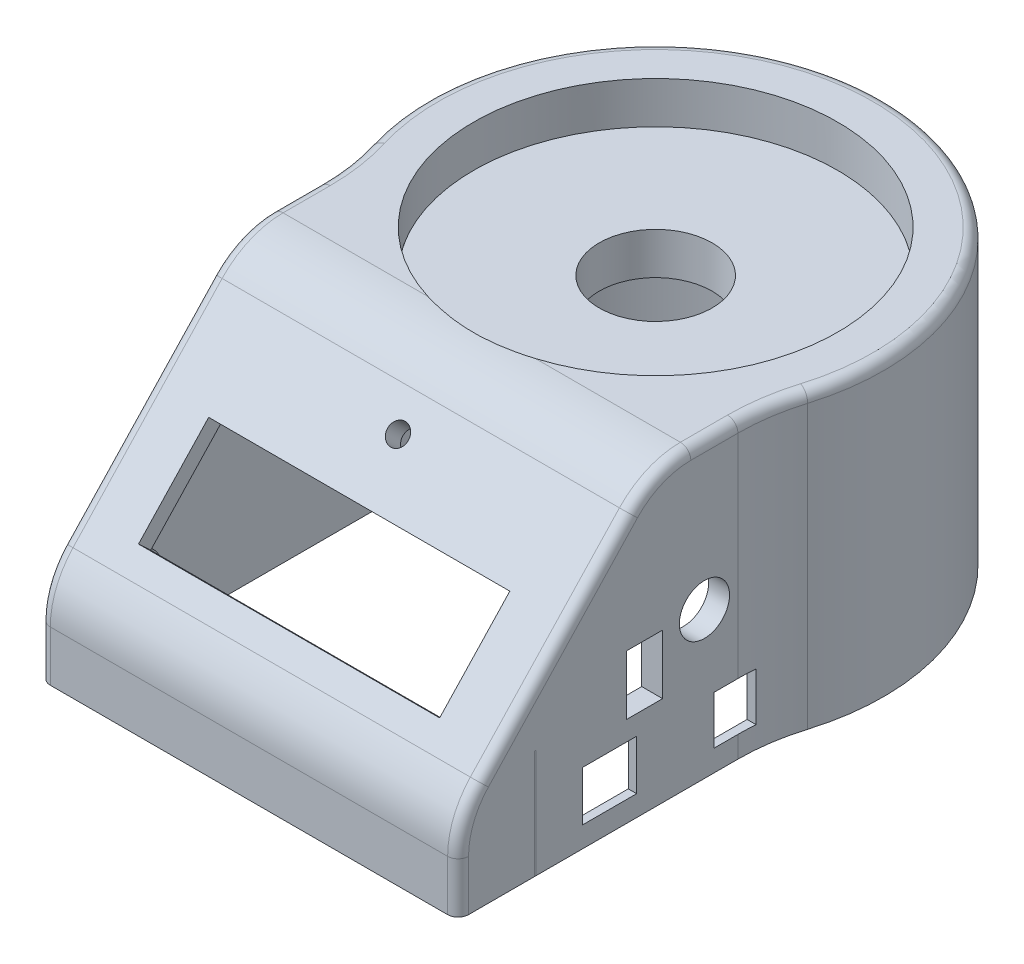
from build123d import *

# Parameters (mm, degrees)
SKETCH1_R                             = 54.5
SKETCH1_R_2                           = 50
BOSS_EXTRUDE1_DEPTH                   = 60
SKETCH2_R                             = 54.5
SKETCH2_R_2                           = 43.525
BOSS_EXTRUDE2_DEPTH                   = 10
BOSS_EXTRUDE4_DEPTH                   = 70
CUT_EXTRUDE3_DEPTH                    = 100
SHELL1_DEPTH                          = 65
SHELL1_START                          = 79.546448744
SHELL1_2_OUTLINE_W                    = 92
SHELL1_2_OUTLINE_H                    = 68
SHELL1_2_DEPTH                        = 5
CUT_EXTRUDE4_DEPTH                    = 60
SKETCH12_W                            = 72
SKETCH12_H                            = 24.5
CUT_EXTRUDE5_DEPTH                    = 4
SKETCH13_W                            = 80
SKETCH13_H                            = 36
CUT_EXTRUDE6_DEPTH                    = 1
SKETCH15_R                            = 2.75
BOSS_EXTRUDE5_DEPTH                   = 7
M3_CLEARANCE_HOLE1_D                  = 3.4
M3_CLEARANCE_HOLE1_DEPTH              = 5
M3_CLEARANCE_HOLE1_CSINK_D            = 3.45
M3_CLEARANCE_HOLE1_CSINK_ANGLE        = 90
M3_CLEARANCE_HOLE1_TIP                = 1.021463052
SKETCH19_R                            = 5
BOSS_EXTRUDE6_DEPTH                   = 15
BOSS_EXTRUDE6_2_DEPTH                 = 15
BOSS_EXTRUDE7_DEPTH                   = 15
SKETCH21_R                            = 5
BOSS_EXTRUDE8_DEPTH                   = 15
TAP_DRILL_FOR_M4X0_7_TAP1_D           = 3.3
TAP_DRILL_FOR_M4X0_7_TAP1_DEPTH       = 15
TAP_DRILL_FOR_M4X0_7_TAP1_CSINK_D     = 3.35
TAP_DRILL_FOR_M4X0_7_TAP1_CSINK_ANGLE = 90
SKETCH24_W                            = 57.3
SKETCH24_H                            = 26
CUT_EXTRUDE7_DEPTH                    = 5
SKETCH25_W                            = 57.3
SKETCH25_H                            = 26
SKETCH25_W_2                          = 12.999996543
SKETCH25_H_2                          = 11.900000274
SKETCH25_W_3                          = 9.900001809
SKETCH25_H_3                          = 11.55991244
BOSS_EXTRUDE9_DEPTH                   = 2
SKETCH26_W                            = 0.338668116
SKETCH26_H                            = 26
BOSS_EXTRUDE10_DEPTH                  = 2
FILLET1_R                             = 50
FILLET2_R                             = 20
FILLET3_R                             = 20
FILLET4_R                             = 2.5
SKETCH27_R                            = 2.5
CUT_EXTRUDE8_DEPTH                    = 5
SKETCH30_W                            = 6
SKETCH30_H                            = 5.001
SKETCH31_R                            = 43.525
SKETCH31_R_2                          = 13.5
BOSS_EXTRUDE11_DEPTH                  = 10
BOSS_EXTRUDE16_DEPTH                  = 10
SKETCH36_W                            = 3
SKETCH36_H                            = 57.3
BOSS_EXTRUDE17_DEPTH                  = 8
SKETCH33_W                            = 8.6
SKETCH33_H                            = 14.2
CUT_EXTRUDE10_DEPTH                   = 8


with BuildPart() as part:
    # Sketch1 → Boss-Extrude1 (new body)
    with BuildSketch(Plane(origin=(0, 0, 0), x_dir=(1, 0, 0), z_dir=(0, 1, 0))):
        with Locations(Location((0, 0, 0), (0, 0, 270))):
            Circle(SKETCH1_R)
        with Locations(Location((0, 0, 0), (0, 0, 270))):
            Circle(SKETCH1_R_2, mode=Mode.SUBTRACT)
    extrude(amount=BOSS_EXTRUDE1_DEPTH)

    # Sketch2 → Boss-Extrude2 (add)
    with BuildSketch(Plane(origin=(0, 60, 0), x_dir=(1, 0, 0), z_dir=(0, 1, 0))):
        with Locations(Location((0, 0, 0), (0, 0, 270))):
            Circle(SKETCH2_R)
        with Locations(Location((0, 0, 0), (0, 0, 270))):
            Circle(SKETCH2_R_2, mode=Mode.SUBTRACT)
    extrude(amount=BOSS_EXTRUDE2_DEPTH)

    # Sketch3 → Boss-Extrude4 (add)
    with BuildSketch(Plane.XZ):
        with BuildLine():
            Line((-50, 0), (-50, 97.235188276))
            Line((-50, 97.235188276), (50, 97.235188276))
            Line((50, 97.235188276), (50, 0))
            ThreePointArc((50, 0), (0, 50), (-50, 0))
        make_face()
    extrude(amount=-BOSS_EXTRUDE4_DEPTH)

    # Sketch4 → Cut-Extrude3 (cut)
    with BuildSketch(Plane(origin=(50, 0, 0), x_dir=(0, 0, -1), z_dir=(1, 0, 0))):
        Polygon((-97.235188276, 70), (-97.235188276, 20), (-50.235188276, 70), align=None)
    extrude(amount=-CUT_EXTRUDE3_DEPTH, mode=Mode.SUBTRACT)

    # Shell1: read off the stored shape, not the designer's step
    # Shell1 outline → Shell1 (cut)
    with BuildSketch(Plane(origin=(0, 0, 0), x_dir=(1, 0, 0), z_dir=(0, 1, 0))):
        with BuildLine():
            Line((45, -92.235188276), (45, -31.622776602))
            ThreePointArc((45, -31.622776602), (0, -55), (-45, -31.622776602))
            Line((-45, -31.622776602), (-45, -92.235188276))
            Line((-45, -92.235188276), (45, -92.235188276))
        make_face()
    extrude(amount=SHELL1_DEPTH, mode=Mode.SUBTRACT)

    # Shell1 2 outline → Shell1 2 (add)
    with BuildSketch(Plane(origin=(0, 0, 0), x_dir=(1, 0, 0), z_dir=(0, 0.6849100087678871, 0.7286276689020071)).offset(SHELL1_START)):
        with Locations((0, -18)):
            Rectangle(SHELL1_2_OUTLINE_W, SHELL1_2_OUTLINE_H)
    extrude(amount=SHELL1_2_DEPTH)

    # Sketch5 → Cut-Extrude4 (cut)
    with BuildSketch(Plane.XZ):
        with BuildLine():
            Line((-45, 31.622776602), (-45, 21.794494718))
            ThreePointArc((-45, 21.794494718), (0, 50), (45, 21.794494718))
            Line((45, 21.794494718), (45, 31.622776602))
            ThreePointArc((45, 31.622776602), (0, 55), (-45, 31.622776602))
        make_face()
    extrude(amount=-CUT_EXTRUDE4_DEPTH, mode=Mode.SUBTRACT)

    # Sketch12 → Cut-Extrude5 (cut)
    with BuildSketch(Plane(origin=(0, 57.906708951, 61.602881862), x_dir=(1, 0, 0), z_dir=(0, 0.6849100087678871, 0.7286276689020071))):
        with Locations((0, -25.774800277)):
            Rectangle(SKETCH12_W, SKETCH12_H)
    extrude(amount=-CUT_EXTRUDE5_DEPTH, mode=Mode.SUBTRACT)

    # Sketch13 → Cut-Extrude6 (cut)
    with BuildSketch(Plane(origin=(0, 54.482158907, 57.959743518), x_dir=(-1, 0, 0), z_dir=(0, -0.6849100087678871, -0.7286276689020071))):
        with Locations((0, -25.024800277)):
            Rectangle(SKETCH13_W, SKETCH13_H)
    extrude(amount=-CUT_EXTRUDE6_DEPTH, mode=Mode.SUBTRACT)

    # Sketch15 → Boss-Extrude5 (add)
    with BuildSketch(Plane(origin=(0, 57.906708951, 61.602881862), x_dir=(1, 0, 0), z_dir=(0, 0.6849100087678871, 0.7286276689020071))):
        with Locations(Location((-37.5, -9.524800277, 0), (0, 0, 270))):
            Circle(SKETCH15_R)
        with Locations(Location((37.5, -9.524800277, 0), (0, 0, 270))):
            Circle(SKETCH15_R)
        with Locations(Location((-37.5, -40.524800277, 0), (0, 0, 270))):
            Circle(SKETCH15_R)
        with Locations(Location((37.5, -40.524800277, 0), (0, 0, 270))):
            Circle(SKETCH15_R)
    extrude(amount=-BOSS_EXTRUDE5_DEPTH)

    # M3 Clearance Hole1
    with Locations(Plane(origin=(0, 53.112338889, 56.50248818), x_dir=(-1, 0, 0), z_dir=(0, -0.6849100087678871, -0.728627668902007))):
        with Locations((-37.5, -9.524800277), (37.5, -9.524800277), (37.5, -40.524800277), (-37.5, -40.524800277)):
            CounterSinkHole(M3_CLEARANCE_HOLE1_D / 2, M3_CLEARANCE_HOLE1_CSINK_D / 2, depth=M3_CLEARANCE_HOLE1_DEPTH, counter_sink_angle=M3_CLEARANCE_HOLE1_CSINK_ANGLE)
            with Locations((0, 0, -(M3_CLEARANCE_HOLE1_DEPTH + M3_CLEARANCE_HOLE1_TIP / 2))):  # 118° drill point
                Cone(0, M3_CLEARANCE_HOLE1_D / 2, M3_CLEARANCE_HOLE1_TIP, mode=Mode.SUBTRACT)



with BuildPart() as body_2:
    # Sketch19 → Boss-Extrude6 (new body)
    with BuildSketch(Plane(origin=(0, 0, 0), x_dir=(-1, 0, 0), z_dir=(0, -1, 0))):
        with Locations(Location((40, -87.235188276, 0), (0, 0, 90))):
            Circle(SKETCH19_R)
    extrude(amount=-BOSS_EXTRUDE6_DEPTH)


with BuildPart() as body_3:
    # Sketch19 → Boss-Extrude6 2 (new body)
    with BuildSketch(Plane(origin=(0, 0, 0), x_dir=(-1, 0, 0), z_dir=(0, -1, 0))):
        with Locations(Location((-40, -87.235188276, 0), (0, 0, 90))):
            Circle(SKETCH19_R)
    extrude(amount=-BOSS_EXTRUDE6_2_DEPTH)


with BuildPart() as part_1:
    add(part.part)

    add(body_2.part)  # Boss-Extrude7 merges body 2

    add(body_3.part)  # Boss-Extrude7 merges body 3
    # Sketch20 → Boss-Extrude7 (add)
    with BuildSketch(Plane.XZ):
        with BuildLine():
            Line((-40, 92.235188276), (-45, 92.235188276))
            Line((-45, 92.235188276), (-45, 87.235188276))
            ThreePointArc((-45, 87.235188276), (-43.535533906, 90.770722182), (-40, 92.235188276))
        make_face()
        with BuildLine():
            Line((40, 92.235188276), (45, 92.235188276))
            Line((45, 92.235188276), (45, 87.235188276))
            ThreePointArc((45, 87.235188276), (43.535533906, 90.770722182), (40, 92.235188276))
        make_face()
    extrude(amount=-BOSS_EXTRUDE7_DEPTH)

    # Sketch21 → Boss-Extrude8 (add)
    with BuildSketch(Plane.XZ):
        with Locations((47, 1.685248442)):
            Circle(SKETCH21_R)
        with Locations((-47, 1.685248442)):
            Circle(SKETCH21_R)
    extrude(amount=-BOSS_EXTRUDE8_DEPTH)

    # Tap Drill for M4x0.7 Tap1
    with Locations(Plane(origin=(-47, 0, 1.685248442), x_dir=(0, 0, -1), z_dir=(0, -1, 0))):
        with Locations((0, 0), (0, 94), (-85.549939834, 87), (-85.549939834, 7)):
            CounterSinkHole(TAP_DRILL_FOR_M4X0_7_TAP1_D / 2, TAP_DRILL_FOR_M4X0_7_TAP1_CSINK_D / 2, depth=TAP_DRILL_FOR_M4X0_7_TAP1_DEPTH, counter_sink_angle=TAP_DRILL_FOR_M4X0_7_TAP1_CSINK_ANGLE)

    # Sketch24 → Cut-Extrude7 (cut)
    with BuildSketch(Plane(origin=(50, 0, 0), x_dir=(0, 0, -1), z_dir=(1, 0, 0))):
        with Locations((-50.335248442, 13)):
            Rectangle(SKETCH24_W, SKETCH24_H)
    extrude(amount=-CUT_EXTRUDE7_DEPTH, mode=Mode.SUBTRACT)

    # Sketch25 → Boss-Extrude9 (add)
    with BuildSketch(Plane(origin=(50, 0, 50), x_dir=(0, 0, 1), z_dir=(1, 0, 0))):
        with Locations((-0.003419674, -13)):
            Rectangle(SKETCH25_W, SKETCH25_H)
        with Locations((11.046582054, -10.90999946)):
            Rectangle(SKETCH25_W_2, SKETCH25_H_2, mode=Mode.SUBTRACT)
        with Locations((-18.903418769, -10.90999946)):
            Rectangle(SKETCH25_W_3, SKETCH25_H_3, mode=Mode.SUBTRACT)
    extrude(amount=-BOSS_EXTRUDE9_DEPTH)

    # Fillet1
    # the kernel refuses this fillet: 50 mm, written as the material it adds along each edge
    with BuildSketch(Plane(origin=(50, 70, 21.685248442), x_dir=(0, 0, 1), z_dir=(0, -1, 0))) as fillet1_piece_1_section:
        with BuildLine():
            CenterArc((8.650374182, -50), FILLET1_R, 90, 16.875500679)
            ThreePointArc((-5.864277791, -2.153110048), (-2.901263551, -1.160648077), (0, 0))
            Line((0, 0), (8.650374182, 0))
        make_face()
    fillet1_piece_1 = extrude(amount=70, mode=Mode.PRIVATE)
    fillet1_piece_1 = split(fillet1_piece_1, bisect_by=Plane(origin=(50, 70, 26.146580326), z_dir=(0, 0, 1)), keep=Keep.TOP, mode=Mode.PRIVATE)
    fillet1_piece_1 = split(fillet1_piece_1, bisect_by=Plane(origin=(50, 16.68995568, 21.685248442), z_dir=(0, 1, 0)), keep=Keep.TOP, mode=Mode.PRIVATE)
    add(fillet1_piece_1)
    with BuildSketch(Plane(origin=(50, 70, 21.685248442), x_dir=(0, 0, 1), z_dir=(0, -1, 0))) as fillet1_piece_2_section:
        with BuildLine():
            CenterArc((8.650374182, -50), FILLET1_R, 90, 16.875500679)
            ThreePointArc((-5.864277791, -2.153110048), (-2.901263551, -1.160648077), (0, 0))
            Line((0, 0), (8.650374182, 0))
        make_face()
    fillet1_piece_2 = extrude(amount=70, mode=Mode.PRIVATE)
    fillet1_piece_2 = split(fillet1_piece_2, bisect_by=Plane(origin=(50, 70, 26.146580326), z_dir=(0, 0, -1)), keep=Keep.TOP, mode=Mode.PRIVATE)
    fillet1_piece_2 = split(fillet1_piece_2, bisect_by=Plane(origin=(50, 16.68995568, 21.685248442), z_dir=(0, 1, 0)), keep=Keep.TOP, mode=Mode.PRIVATE)
    add(fillet1_piece_2)
    with BuildSketch(Plane(origin=(50, 70, 21.685248442), x_dir=(0, 0, 1), z_dir=(0, -1, 0))) as fillet1_piece_3_section:
        with BuildLine():
            CenterArc((8.650374182, -50), FILLET1_R, 90, 16.875500679)
            ThreePointArc((-5.864277791, -2.153110048), (-2.901263551, -1.160648077), (0, 0))
            Line((0, 0), (8.650374182, 0))
        make_face()
    fillet1_piece_3 = extrude(amount=70, mode=Mode.PRIVATE)
    fillet1_piece_3 = split(fillet1_piece_3, bisect_by=Plane(origin=(50, 5.13004324, 21.685248442), z_dir=(0, 1, 0)), keep=Keep.TOP, mode=Mode.PRIVATE)
    fillet1_piece_3 = split(fillet1_piece_3, bisect_by=Plane(origin=(50, 70, 26.146580326), z_dir=(0, 0, -1)), keep=Keep.TOP, mode=Mode.PRIVATE)
    fillet1_piece_3 = split(fillet1_piece_3, bisect_by=Plane(origin=(50, 16.68995568, 21.685248442), z_dir=(0, -1, 0)), keep=Keep.TOP, mode=Mode.PRIVATE)
    add(fillet1_piece_3)
    with BuildSketch(Plane(origin=(50, 70, 21.685248442), x_dir=(0, 0, 1), z_dir=(0, -1, 0))) as fillet1_piece_4_section:
        with BuildLine():
            CenterArc((8.650374182, -50), FILLET1_R, 90, 16.875500679)
            ThreePointArc((-5.864277791, -2.153110048), (-2.901263551, -1.160648077), (0, 0))
            Line((0, 0), (8.650374182, 0))
        make_face()
    fillet1_piece_4 = extrude(amount=70, mode=Mode.PRIVATE)
    fillet1_piece_4 = split(fillet1_piece_4, bisect_by=Plane(origin=(50, 5.13004324, 21.685248442), z_dir=(0, -1, 0)), keep=Keep.TOP, mode=Mode.PRIVATE)
    fillet1_piece_4 = split(fillet1_piece_4, bisect_by=Plane(origin=(50, 70, 26.146580326), z_dir=(0, 0, 1)), keep=Keep.TOP, mode=Mode.PRIVATE)
    add(fillet1_piece_4)
    with BuildSketch(Plane(origin=(50, 70, 21.685248442), x_dir=(0, 0, 1), z_dir=(0, -1, 0))) as fillet1_piece_5_section:
        with BuildLine():
            CenterArc((8.650374182, -50), FILLET1_R, 90, 16.875500679)
            ThreePointArc((-5.864277791, -2.153110048), (-2.901263551, -1.160648077), (0, 0))
            Line((0, 0), (8.650374182, 0))
        make_face()
    fillet1_piece_5 = extrude(amount=70, mode=Mode.PRIVATE)
    fillet1_piece_5 = split(fillet1_piece_5, bisect_by=Plane(origin=(50, 5.13004324, 21.685248442), z_dir=(0, -1, 0)), keep=Keep.TOP, mode=Mode.PRIVATE)
    fillet1_piece_5 = split(fillet1_piece_5, bisect_by=Plane(origin=(50, 70, 26.146580326), z_dir=(0, 0, -1)), keep=Keep.TOP, mode=Mode.PRIVATE)
    add(fillet1_piece_5)
    with BuildSketch(Plane(origin=(-50, 70, 21.685248442), x_dir=(-0.3446602732291026, 0, -0.9387274876435868), z_dir=(0, -1, 0))) as fillet1_piece_6:
        with BuildLine():
            CenterArc((9.112669638, -49.917814711), FILLET1_R, 93.285558288, 16.875500679)
            Line((-8.120344023, -2.981440329), (0, 0))
            ThreePointArc((0, 0), (3.123525128, -0.089581965), (6.247050255, 0))
        make_face()
    extrude(amount=70)

    # Fillet2
    fillet2_edges = [part_1.edges().sort_by_distance(p)[0] for p in [
        (0, 20, 97.235188276),
    ]]
    fillet(fillet2_edges, radius=FILLET2_R)

    # Fillet3
    # the kernel refuses this fillet: 20 mm, written as the material it takes off along each edge
    with BuildSketch(Plane(origin=(71.622153857, 70, 50.235188276), x_dir=(0, -0.7286276689020077, 0.6849100087678863), z_dir=(-1, 0, 0))) as fillet3_piece_1:
        with BuildLine():
            CenterArc((FILLET3_R * 0.432443077144, -FILLET3_R), FILLET3_R, 90, 46.77146974)
            Line((-FILLET3_R * 0.296184591758, -FILLET3_R * 0.315089991232), (0, 0))
            Line((0, 0), (FILLET3_R * 0.432443077144, 0))
        make_face()
    extrude(amount=143.244307714, mode=Mode.SUBTRACT)

    # Fillet4
    fillet4_edges = [part_1.edges().sort_by_distance(p)[0] for p in [
        (0, 70, -54.5),
        (-50, 70, 35.960974679),
        (50.541206557, 70, 22.998882804),
        (-50.541206557, 70, 22.998882804),
        (50, 6.037839605, 97.235188276),
        (50, 19.442799829, 95.828884352),
        (-50, 6.037839605, 97.235188276),
        (-50, 19.442799829, 95.828884352),
        (50, 70, 35.960974679),
        (50, 44.73603978, 73.983310883),
        (50, 68.357069531, 49.524714368),
        (-50, 44.73603978, 73.983310883),
        (-50, 68.357069531, 49.524714368),
    ]]
    fillet(fillet4_edges, radius=FILLET4_R)

    # Sketch27 → Cut-Extrude8 (cut)
    with BuildSketch(Plane(origin=(0, 54.482158907, 57.959743518), x_dir=(-1, 0, 0), z_dir=(0, -0.6849100087678871, -0.7286276689020071))):
        with Locations(Location((0, 0, 0), (0, 0, 90))):
            Circle(SKETCH27_R)
    extrude(amount=-CUT_EXTRUDE8_DEPTH, mode=Mode.SUBTRACT)

    # Sketch30 → Hole1 (revolve, cut)
    with BuildSketch(Plane(origin=(50, 35, 38.335622624), x_dir=(0, 0, -1), z_dir=(0, 1, 0))):
        with Locations((3, 2.5005)):
            Rectangle(SKETCH30_W, SKETCH30_H)
    revolve(axis=Axis((-60, 35, 38.335622624), (1, 0, 0)), mode=Mode.SUBTRACT)

    # Sketch36 → Boss-Extrude17 (add)
    with BuildSketch(Plane.XZ.offset(-26)):
        with Locations((46.5, 50.335248442)):
            Rectangle(SKETCH36_W, SKETCH36_H)
    extrude(amount=BOSS_EXTRUDE17_DEPTH)

    # Sketch33 → Cut-Extrude10 (cut)
    with BuildSketch(Plane(origin=(50, 0, 0), x_dir=(0, 0, -1), z_dir=(1, 0, 0))):
        with Locations((-52.635622624, 28.634494343)):
            Rectangle(SKETCH33_W, SKETCH33_H)
    extrude(amount=-CUT_EXTRUDE10_DEPTH, mode=Mode.SUBTRACT)


with BuildPart() as body_2_2:
    # Sketch26 → Boss-Extrude10 (new body)
    with BuildSketch(Plane(origin=(50, 0, 0), x_dir=(0, 0, -1), z_dir=(1, 0, 0))):
        with Locations((-78.815914384, 13)):
            Rectangle(SKETCH26_W, SKETCH26_H)
    extrude(amount=-BOSS_EXTRUDE10_DEPTH)


with BuildPart() as body_3_2:
    # Sketch31 → Boss-Extrude11 (new body)
    with BuildSketch(Plane.XZ.offset(-60)):
        with Locations(Location((0, 0, 0), (0, 0, 270))):
            Circle(SKETCH31_R)
        with Locations(Location((0, 0, 0), (0, 0, 270))):
            Circle(SKETCH31_R_2, mode=Mode.SUBTRACT)
    extrude(amount=BOSS_EXTRUDE11_DEPTH)


with BuildPart() as body_4:
    # Sketch32 → Boss-Extrude16 (new body)
    with BuildSketch(Plane.XZ.offset(-60)):
        with BuildLine():
            Line((-45, 21.794494718), (-37.675265427, 21.794494718))
            ThreePointArc((-37.675265427, 21.794494718), (0, -43.525), (37.675265427, 21.794494718))
            Line((37.675265427, 21.794494718), (45, 21.794494718))
            ThreePointArc((45, 21.794494718), (0, -50), (-45, 21.794494718))
        make_face()
    extrude(amount=BOSS_EXTRUDE16_DEPTH)


solid = Compound([part_1.part, body_2_2.part, body_3_2.part, body_4.part])
